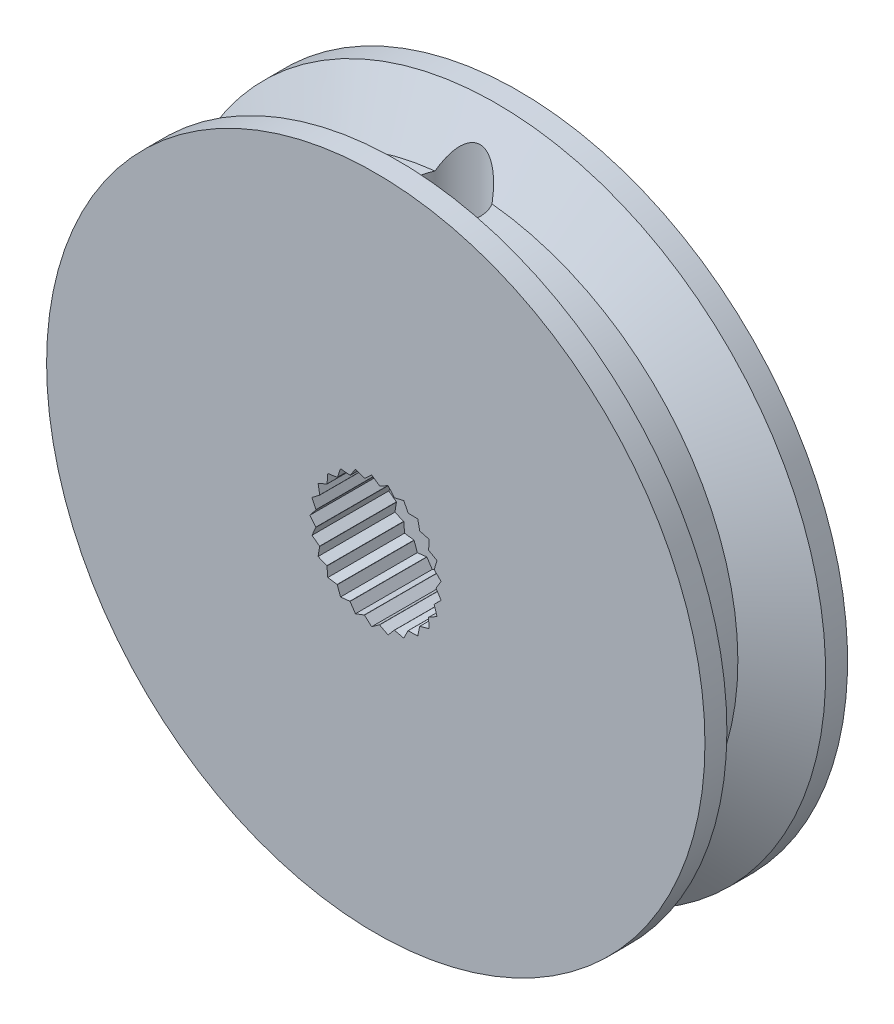
from build123d import *
from OCP.BRepAlgoAPI import BRepAlgoAPI_Cut
from OCP.TopTools import TopTools_ListOfShape

# Parameters (mm, degrees)
SKETCH1_R           = 15
SKETCH1_R_2         = 4.5
BOSS_EXTRUDE1_DEPTH = 1
BOSS_EXTRUDE2_START = -3.5
SKETCH1_2_R         = 4.5
BOSS_EXTRUDE2_DEPTH = 4.5
SKETCH2_R           = 1.5
CUT_EXTRUDE1_DEPTH  = 4.5
CUT_EXTRUDE2_START  = -4.5
SKETCH3_R           = 2.75
CUT_EXTRUDE2_DEPTH  = 3.5
CUT_EXTRUDE3_START  = -4.5
CUT_EXTRUDE3_DEPTH  = 3.5
CIRPATTERN1_COUNT   = 25
CUT_EXTRUDE4_START  = 9.886861
SKETCH6_R           = 1.5
CUT_EXTRUDE4_DEPTH  = 3.863123


with BuildPart() as part:
    # Sketch1 → Boss-Extrude1 (new body)
    with BuildSketch(Plane.XY):
        Circle(SKETCH1_R)
        Circle(SKETCH1_R_2, mode=Mode.SUBTRACT)
    extrude(amount=BOSS_EXTRUDE1_DEPTH)

    # Sketch1<2> → Boss-Extrude2 (add)
    with BuildSketch(Plane.XY.offset(BOSS_EXTRUDE2_START)):
        Circle(SKETCH1_2_R)
    extrude(amount=BOSS_EXTRUDE2_DEPTH)

    # Sketch2 → Cut-Extrude1 (cut)
    with BuildSketch(Plane(origin=(0, 0, 0), x_dir=(-1, 0, 0), z_dir=(0, 0, -1))):
        with Locations(Location((0, 0, 0), (0, 0, 180))):
            Circle(SKETCH2_R)
    extrude(amount=CUT_EXTRUDE1_DEPTH, mode=Mode.SUBTRACT)

    # Sketch3 → Cut-Extrude2 (cut)
    with BuildSketch(Plane(origin=(0, 0, -3.5), x_dir=(-1, 0, 0), z_dir=(0, 0, -1)).offset(CUT_EXTRUDE2_START)):
        with Locations(Location((0, 0, 0), (0, 0, 180))):
            Circle(SKETCH3_R)
    extrude(amount=CUT_EXTRUDE2_DEPTH, mode=Mode.SUBTRACT)

    # Sketch4 → Cut-Extrude3 (cut)
    with BuildSketch(Plane(origin=(0, 0, -3.5), x_dir=(-1, 0, 0), z_dir=(0, 0, -1)).offset(CUT_EXTRUDE3_START)):
        with BuildLine():
            Line((-2.665974712, 0.674595311), (-2.976344104, 0.375999701))
            Line((-2.976344104, 0.375999701), (-2.728315429, 0.344666392))
            ThreePointArc((-2.728315429, 0.344666392), (-2.70218519, 0.510583192), (-2.665974712, 0.674595311))
        make_face()
        with BuildLine():
            Line((-2.976344104, 0.375999701), (-2.75, 0))
            ThreePointArc((-2.75, 0), (-2.744573503, 0.172673929), (-2.728315429, 0.344666392))
            Line((-2.728315429, 0.344666392), (-2.976344104, 0.375999701))
        make_face()
    cut_extrude3 = extrude(amount=CUT_EXTRUDE3_DEPTH, mode=Mode.SUBTRACT)

    # CirPattern1: Cut-Extrude3 ×25 about axis
    cirpattern1_axis = Axis((0, 0, 0), (0, 0, 1))
    for i in range(1, CIRPATTERN1_COUNT):
        add(cut_extrude3.rotate(cirpattern1_axis, i * 360 / CIRPATTERN1_COUNT), mode=Mode.SUBTRACT)

    # Sketch5 → Revolve1 (revolve)
    with BuildSketch(Plane(origin=(0, 0, 0), x_dir=(1, 0, 0), z_dir=(0, 1, 0))):
        Polygon((-15, 0), (-12.5, 1.5), (-12.5, 3), (-15, 4.5), (-15, 5.5), (-10, 5.5), (-10, 0), align=None)
    revolve(axis=Axis((0, 0, -2.5), (0, 0, 1)))


with BuildPart() as cut_extrude4_tool:
    # Sketch6 → Cut-Extrude4 (new body)
    with BuildSketch(Plane(origin=(0, 0, 0), x_dir=(1, 0, 0), z_dir=(0, 1, 0)).offset(CUT_EXTRUDE4_START)):
        with Locations((0, 2.25)):
            Circle(SKETCH6_R)
    extrude(amount=CUT_EXTRUDE4_DEPTH)


with BuildPart() as part_1:
    add(part.part)

    # Cut-Extrude4: cut by cut_extrude4_tool, with a tolerance
    cut_extrude4_stock = TopTools_ListOfShape()
    cut_extrude4_stock.Append(part_1.part.wrapped)
    cut_extrude4_tools = TopTools_ListOfShape()
    cut_extrude4_tools.Append(cut_extrude4_tool.part.wrapped)
    cut_extrude4_cut = BRepAlgoAPI_Cut()
    cut_extrude4_cut.SetArguments(cut_extrude4_stock)
    cut_extrude4_cut.SetTools(cut_extrude4_tools)
    cut_extrude4_cut.SetFuzzyValue(0.00001)
    cut_extrude4_cut.Build()
    add(Compound.cast(cut_extrude4_cut.Shape()).solids(), mode=Mode.REPLACE)


solid = part_1.part
